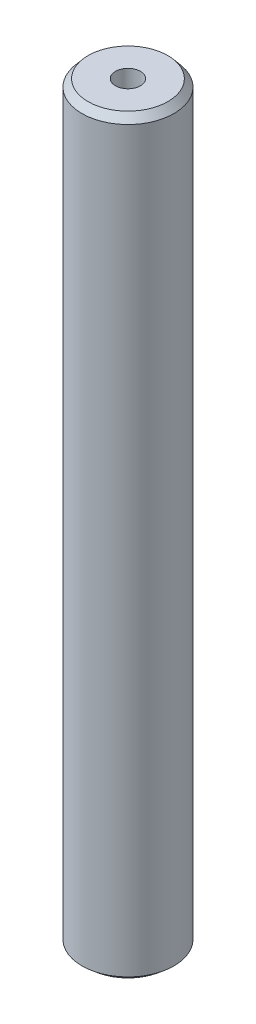
from build123d import *
from OCP.BRepFilletAPI import BRepFilletAPI_MakeChamfer

# Parameters (mm, degrees)
SKETCH1_R           = 17.5
BOSS_EXTRUDE1_DEPTH = 285.872211947
SKETCH2_R           = 4.764737704
CUT_EXTRUDE1_DEPTH  = 287.941495018
CHAMFER1_SIZE       = 2.777589563
CHAMFER1_SIZE2      = 2.321053911


with BuildPart() as part:
    # Sketch1 → Boss-Extrude1 (new body)
    with BuildSketch(Plane(origin=(0, 0, 0), x_dir=(1, 0, 0), z_dir=(0, 1, 0))):
        Circle(SKETCH1_R)
    extrude(amount=BOSS_EXTRUDE1_DEPTH)

    # Sketch2 → Cut-Extrude1 (cut, through all)
    with BuildSketch(Plane(origin=(0, 0, 0), x_dir=(1, 0, 0), z_dir=(0, 1, 0))):
        Circle(SKETCH2_R)
    extrude(amount=CUT_EXTRUDE1_DEPTH, mode=Mode.SUBTRACT)

    # Chamfer1: one chamfer whose edges measure the first distance from different faces: ONE call of the kernel's chamfer builder (chamfer() names one face for all edges)
    chamfer1_edges_1 = [part.edges().sort_by_distance(p)[0] for p in [
        (-17.5, 285.872211947, 0),
    ]]
    chamfer1_side_1 = [part.faces().sort_by_distance(p)[0] for p in [
        (-17.5, 142.936105973, 0),
    ]]
    chamfer1_edges_2 = [part.edges().sort_by_distance(p)[0] for p in [
        (-17.5, 0, 0),
    ]]
    chamfer1_side_2 = [part.faces().sort_by_distance(p)[0] for p in [
        (-17.005025253, 0, 0),
    ]]
    chamfer1 = BRepFilletAPI_MakeChamfer(part.part.solid().wrapped)
    for e in chamfer1_edges_1:
        chamfer1.Add(CHAMFER1_SIZE, CHAMFER1_SIZE2, e.wrapped, chamfer1_side_1[0].wrapped)  # the first distance lies on this face
    for e in chamfer1_edges_2:
        chamfer1.Add(CHAMFER1_SIZE, CHAMFER1_SIZE2, e.wrapped, chamfer1_side_2[0].wrapped)  # the first distance lies on this face
    add(Compound.cast(chamfer1.Shape()), mode=Mode.REPLACE)


solid = part.part
